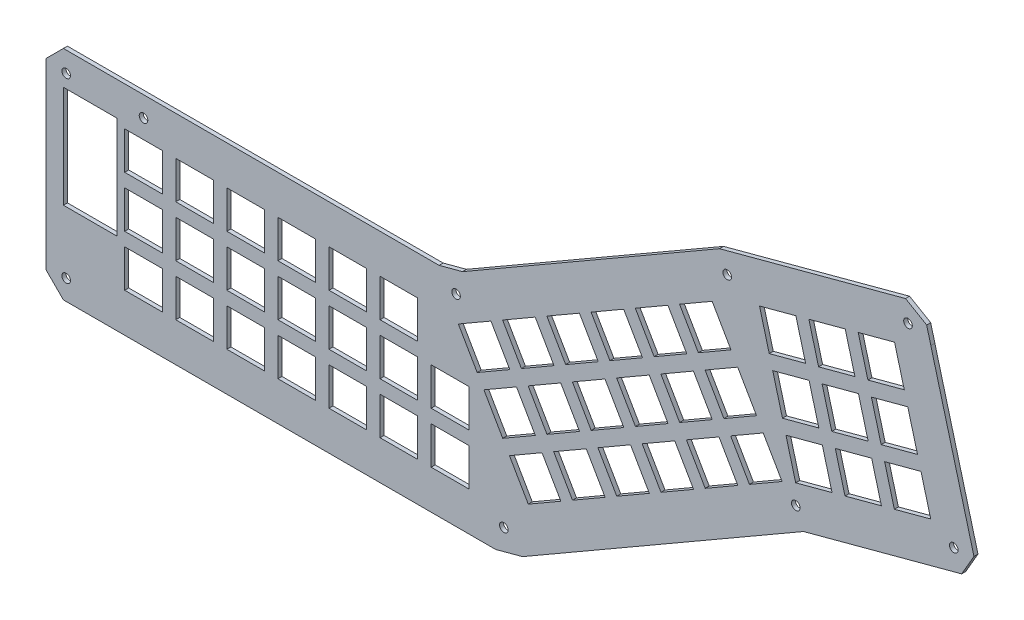
from build123d import *

# Parameters (mm, degrees)
ESQUISSE1_R        = 1.6
ESQUISSE1_W        = 14
ESQUISSE1_H        = 14
ESQUISSE1_W_2      = 20
ESQUISSE1_H_2      = 38
BOSS_EXTRU_1_DEPTH = 1.5


with BuildPart() as part:
    # Esquisse1 → Boss.-Extru.1 (new body)
    with BuildSketch(Plane.XY):
        Polygon((-75.988646329, 51.585106383), (42.975455994, 51.585106383), (51.669750275, 53.914735514), (147.250925797, 109.098552931), (210.540810955, 126.057026548), (216.430520531, 127.635169473), (224.324263617, 123.047292559), (225.851989006, 117.211223452), (230.508864659, 99.83152691), (241.906099495, 57.296467436), (237.335031683, 49.379145741), (178.515758799, 33.618569072), (73.963816863, -26.744522748), (63.997857106, -29.414893617), (-96.789296468, -29.414893617), (-103.253762562, -22.950427523), (-103.253762562, 35.79522772), (-103.253762562, 45.120640289), (-96.789296468, 51.585106383), align=None)
        with Locations((-95.753762562, 44.085106383)):
            Circle(ESQUISSE1_R, mode=Mode.SUBTRACT)
        with Locations((-66.988646329, 44.085106383)):
            Circle(ESQUISSE1_R, mode=Mode.SUBTRACT)
        with Locations((-95.753762562, -21.914893617)):
            Circle(ESQUISSE1_R, mode=Mode.SUBTRACT)
        with Locations((67.039694146, -20.835264486)):
            Circle(ESQUISSE1_R, mode=Mode.SUBTRACT)
        with Locations((49.263745973, 45.505477252)):
            Circle(ESQUISSE1_R, mode=Mode.SUBTRACT)
        with Locations((175.637377655, 40.567595866)):
            Circle(ESQUISSE1_R, mode=Mode.SUBTRACT)
        with Locations((150.12930694, 102.149526137)):
            Circle(ESQUISSE1_R, mode=Mode.SUBTRACT)
        with Locations((217.363403759, 120.120565138)):
            Circle(ESQUISSE1_R, mode=Mode.SUBTRACT)
        with Locations((234.393639901, 56.355573542)):
            Circle(ESQUISSE1_R, mode=Mode.SUBTRACT)
        with Locations((-66.988646329, 11.085106383)):
            Rectangle(ESQUISSE1_W, ESQUISSE1_H, mode=Mode.SUBTRACT)
        with Locations((-66.988646329, 30.085106383)):
            Rectangle(ESQUISSE1_W, ESQUISSE1_H, mode=Mode.SUBTRACT)
        with Locations((-66.988646329, -7.914893617)):
            Rectangle(ESQUISSE1_W, ESQUISSE1_H, mode=Mode.SUBTRACT)
        with Locations((-47.988646329, 11.085106383)):
            Rectangle(ESQUISSE1_W, ESQUISSE1_H, mode=Mode.SUBTRACT)
        with Locations((-47.988646329, 30.085106383)):
            Rectangle(ESQUISSE1_W, ESQUISSE1_H, mode=Mode.SUBTRACT)
        with Locations((-47.988646329, -7.914893617)):
            Rectangle(ESQUISSE1_W, ESQUISSE1_H, mode=Mode.SUBTRACT)
        with Locations((-28.988646329, 11.085106383)):
            Rectangle(ESQUISSE1_W, ESQUISSE1_H, mode=Mode.SUBTRACT)
        with Locations((-28.988646329, 30.085106383)):
            Rectangle(ESQUISSE1_W, ESQUISSE1_H, mode=Mode.SUBTRACT)
        with Locations((-28.988646329, -7.914893617)):
            Rectangle(ESQUISSE1_W, ESQUISSE1_H, mode=Mode.SUBTRACT)
        with Locations((-9.988646329, 11.085106383)):
            Rectangle(ESQUISSE1_W, ESQUISSE1_H, mode=Mode.SUBTRACT)
        with Locations((-9.988646329, 30.085106383)):
            Rectangle(ESQUISSE1_W, ESQUISSE1_H, mode=Mode.SUBTRACT)
        with Locations((-9.988646329, -7.914893617)):
            Rectangle(ESQUISSE1_W, ESQUISSE1_H, mode=Mode.SUBTRACT)
        with Locations((9.011353671, 11.085106383)):
            Rectangle(ESQUISSE1_W, ESQUISSE1_H, mode=Mode.SUBTRACT)
        with Locations((9.011353671, 30.085106383)):
            Rectangle(ESQUISSE1_W, ESQUISSE1_H, mode=Mode.SUBTRACT)
        with Locations((9.011353671, -7.914893617)):
            Rectangle(ESQUISSE1_W, ESQUISSE1_H, mode=Mode.SUBTRACT)
        with Locations((28.011353671, 11.085106383)):
            Rectangle(ESQUISSE1_W, ESQUISSE1_H, mode=Mode.SUBTRACT)
        with Locations((28.011353671, 30.085106383)):
            Rectangle(ESQUISSE1_W, ESQUISSE1_H, mode=Mode.SUBTRACT)
        with Locations((28.011353671, -7.914893617)):
            Rectangle(ESQUISSE1_W, ESQUISSE1_H, mode=Mode.SUBTRACT)
        with Locations((47.011353671, 11.085106383)):
            Rectangle(ESQUISSE1_W, ESQUISSE1_H, mode=Mode.SUBTRACT)
        with Locations((47.011353671, -7.914893617)):
            Rectangle(ESQUISSE1_W, ESQUISSE1_H, mode=Mode.SUBTRACT)
        Polygon((69.12536992, 3.37096395), (76.12536992, -8.753391703), (88.249725572, -1.753391703), (81.249725572, 10.37096395), align=None, mode=Mode.SUBTRACT)
        Polygon((59.62536992, 19.825446622), (66.62536992, 7.701090969), (78.749725572, 14.701090969), (71.749725572, 26.825446622), align=None, mode=Mode.SUBTRACT)
        Polygon((50.12536992, 36.279929294), (57.12536992, 24.155573641), (69.249725572, 31.155573641), (62.249725572, 43.279929294), align=None, mode=Mode.SUBTRACT)
        Polygon((85.579852591, 12.87096395), (92.579852591, 0.746608297), (104.704208244, 7.746608297), (97.704208244, 19.87096395), align=None, mode=Mode.SUBTRACT)
        Polygon((76.079852591, 29.325446622), (83.079852591, 17.201090969), (95.204208244, 24.201090969), (88.204208244, 36.325446622), align=None, mode=Mode.SUBTRACT)
        Polygon((66.579852591, 45.779929294), (73.579852591, 33.655573641), (85.704208244, 40.655573641), (78.704208244, 52.779929294), align=None, mode=Mode.SUBTRACT)
        Polygon((102.034335263, 22.37096395), (109.034335263, 10.246608297), (121.158690916, 17.246608297), (114.158690916, 29.37096395), align=None, mode=Mode.SUBTRACT)
        Polygon((92.534335263, 38.825446622), (99.534335263, 26.701090969), (111.658690916, 33.701090969), (104.658690916, 45.825446622), align=None, mode=Mode.SUBTRACT)
        Polygon((83.034335263, 55.279929294), (90.034335263, 43.155573641), (102.158690916, 50.155573641), (95.158690916, 62.279929294), align=None, mode=Mode.SUBTRACT)
        Polygon((118.488817935, 31.87096395), (125.488817935, 19.746608297), (137.613173588, 26.746608297), (130.613173588, 38.87096395), align=None, mode=Mode.SUBTRACT)
        Polygon((108.988817935, 48.325446622), (115.988817935, 36.201090969), (128.113173588, 43.201090969), (121.113173588, 55.325446622), align=None, mode=Mode.SUBTRACT)
        Polygon((99.488817935, 64.779929294), (106.488817935, 52.655573641), (118.613173588, 59.655573641), (111.613173588, 71.779929294), align=None, mode=Mode.SUBTRACT)
        Polygon((134.943300607, 41.37096395), (141.943300607, 29.246608297), (154.06765626, 36.246608297), (147.06765626, 48.37096395), align=None, mode=Mode.SUBTRACT)
        Polygon((125.443300607, 57.825446622), (132.443300607, 45.701090969), (144.56765626, 52.701090969), (137.56765626, 64.825446622), align=None, mode=Mode.SUBTRACT)
        Polygon((115.943300607, 74.279929294), (122.943300607, 62.155573641), (135.06765626, 69.155573641), (128.06765626, 81.279929294), align=None, mode=Mode.SUBTRACT)
        Polygon((151.397783279, 50.87096395), (158.397783279, 38.746608297), (170.522138932, 45.746608297), (163.522138932, 57.87096395), align=None, mode=Mode.SUBTRACT)
        Polygon((141.897783279, 67.325446622), (148.897783279, 55.201090969), (161.022138932, 62.201090969), (154.022138932, 74.325446622), align=None, mode=Mode.SUBTRACT)
        Polygon((132.397783279, 83.779929294), (139.397783279, 71.655573641), (151.522138932, 78.655573641), (144.522138932, 90.779929294), align=None, mode=Mode.SUBTRACT)
        Polygon((167.051254346, 79.722282932), (180.574215914, 83.345749564), (184.197682546, 69.822787996), (170.674720978, 66.199321364), align=None, mode=Mode.SUBTRACT)
        Polygon((162.133692489, 98.074873632), (175.656654057, 101.698340263), (179.280120689, 88.175378695), (165.757159121, 84.551912064), align=None, mode=Mode.SUBTRACT)
        Polygon((171.968816203, 61.369692233), (185.491777771, 64.993158864), (189.115244403, 51.470197296), (175.592282834, 47.846730665), align=None, mode=Mode.SUBTRACT)
        Polygon((185.403845046, 84.639844789), (198.926806614, 88.263311421), (202.550273245, 74.740349853), (189.027311677, 71.116883221), align=None, mode=Mode.SUBTRACT)
        Polygon((180.486283189, 102.992435489), (194.009244757, 106.61590212), (197.632711388, 93.092940552), (184.10974982, 89.469473921), align=None, mode=Mode.SUBTRACT)
        Polygon((190.321406903, 66.28725409), (203.844368471, 69.910720721), (207.467835102, 56.387759153), (193.944873534, 52.764292522), align=None, mode=Mode.SUBTRACT)
        Polygon((203.756435745, 89.557406646), (217.279397313, 93.180873278), (220.902863945, 79.65791171), (207.379902377, 76.034445078), align=None, mode=Mode.SUBTRACT)
        Polygon((198.838873888, 107.909997346), (212.361835456, 111.533463977), (215.985302088, 98.010502409), (202.46234052, 94.387035778), align=None, mode=Mode.SUBTRACT)
        Polygon((208.673997602, 71.204815947), (222.19695917, 74.828282578), (225.820425801, 61.30532101), (212.297464233, 57.681854379), align=None, mode=Mode.SUBTRACT)
        with Locations((-86.753762562, 20.085106383)):
            Rectangle(ESQUISSE1_W_2, ESQUISSE1_H_2, mode=Mode.SUBTRACT)
    extrude(amount=BOSS_EXTRU_1_DEPTH)


solid = part.part
